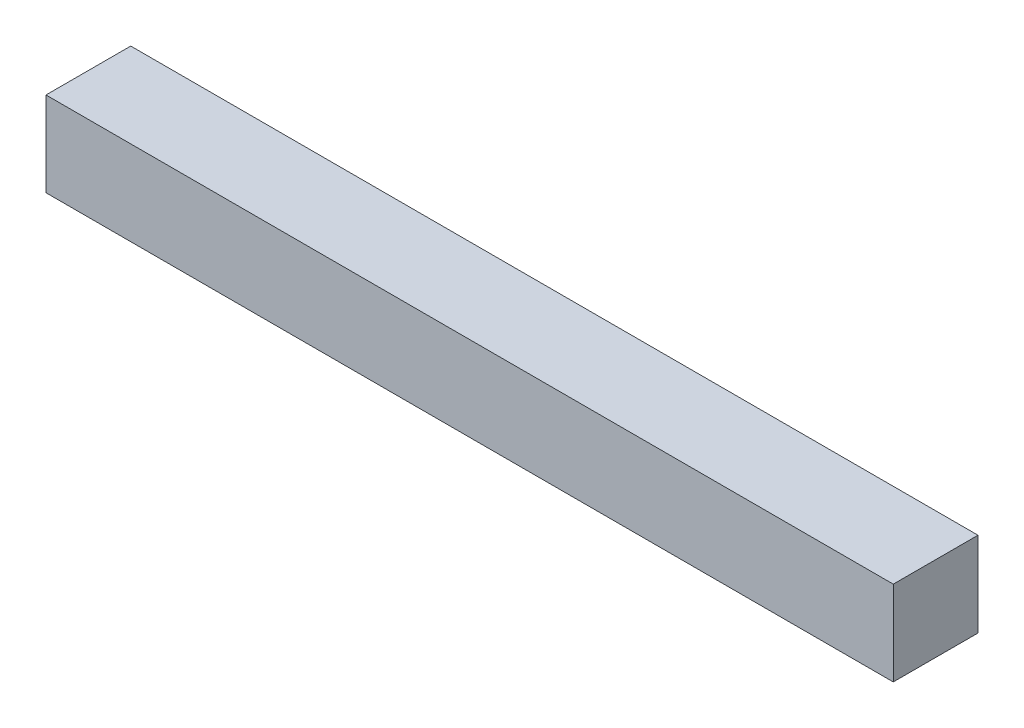
from build123d import *

# Parameters (mm, degrees)
ESQUISSE1_W        = 10
ESQUISSE1_H        = 10
BOSS_EXTRU_1_DEPTH = 100


with BuildPart() as part:
    # Esquisse1 → Boss.-Extru.1 (new body)
    with BuildSketch(Plane(origin=(0, 0, 0), x_dir=(0, 0, -1), z_dir=(1, 0, 0))):
        Rectangle(ESQUISSE1_W, ESQUISSE1_H)
    extrude(amount=BOSS_EXTRU_1_DEPTH)


solid = part.part
